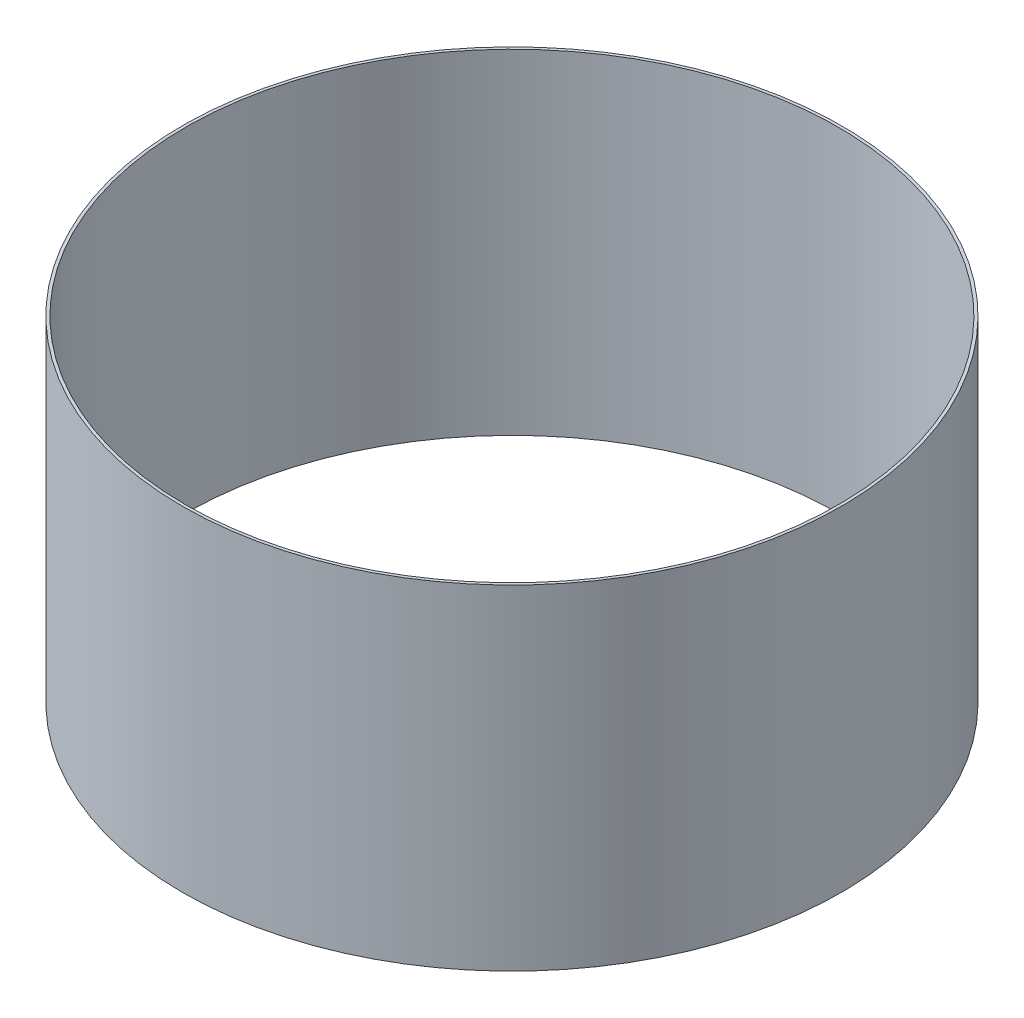
from build123d import *

# Parameters (mm, degrees)
SKETCH2_W = 1.524
SKETCH2_H = 177.8


with BuildPart() as part:
    # Sketch2 → Revolve1 (revolve)
    with BuildSketch(Plane.XY):
        with Locations((-174.461188406, -24.801811594)):
            Rectangle(SKETCH2_W, SKETCH2_H)
    revolve(axis=Axis((0, 64.098188406, 0), (0, -1, 0)))


solid = part.part
